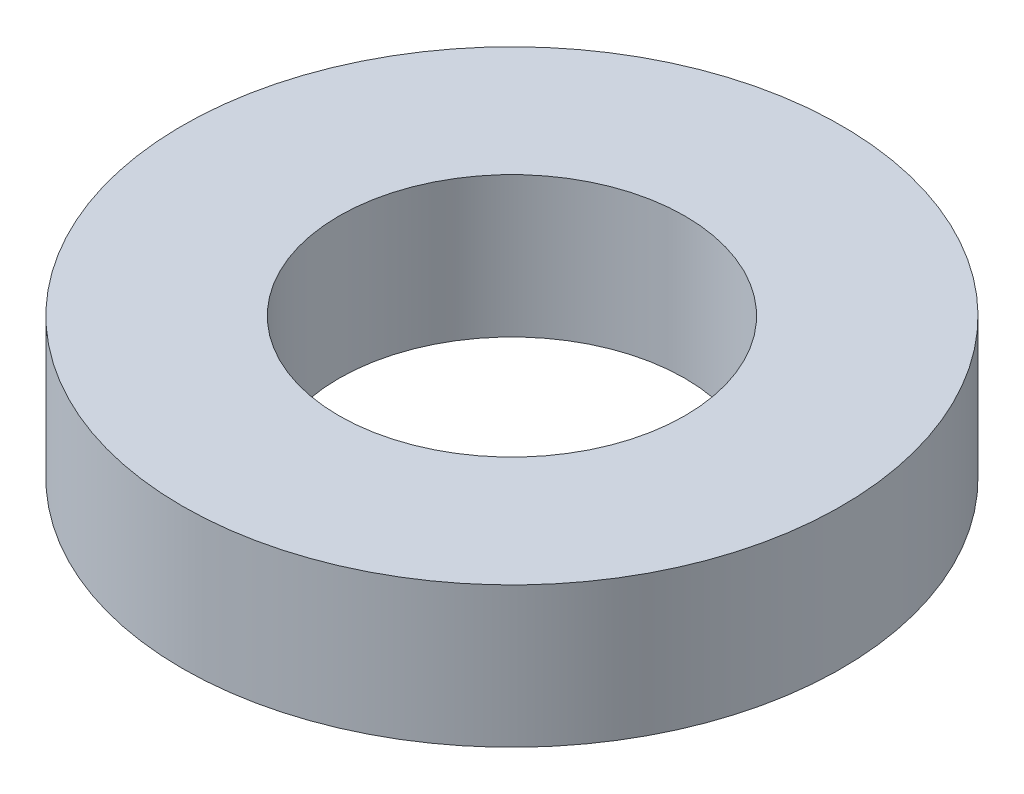
from build123d import *

# Parameters (mm, degrees)
SKETCH1_R           = 4.7625
SKETCH1_R_2         = 2.499999953
BOSS_EXTRUDE1_DEPTH = 2.032


with BuildPart() as part:
    # Sketch1 → Boss-Extrude1 (new body)
    with BuildSketch(Plane(origin=(0, 0, 0), x_dir=(1, 0, 0), z_dir=(0, 1, 0))):
        Circle(SKETCH1_R)
        Circle(SKETCH1_R_2, mode=Mode.SUBTRACT)
    extrude(amount=BOSS_EXTRUDE1_DEPTH)


solid = part.part
